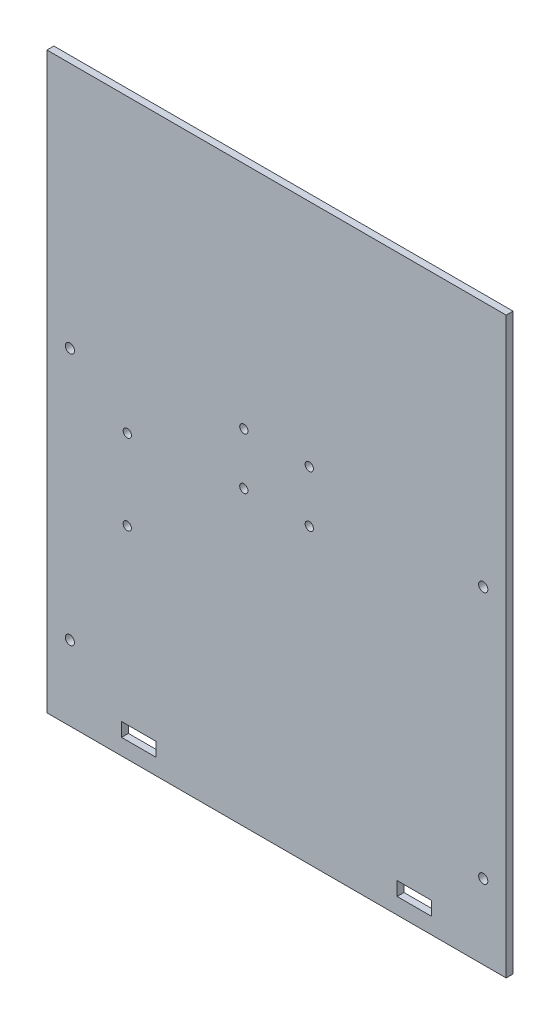
from build123d import *

# Parameters (mm, degrees)
ESBO_O1_W                = 200
ESBO_O1_H                = 250
ESBO_O1_R                = 1.8
ESBO_O1_R_2              = 2
ESBO_O1_W_2              = 15
ESBO_O1_H_2              = 6
RESSALTO_EXTRUS_O1_DEPTH = 3


with BuildPart() as part:
    # Esboço1 → Ressalto-extrusão1 (new body)
    with BuildSketch(Plane.XY):
        Rectangle(ESBO_O1_W, ESBO_O1_H)
        with Locations((-14.25, 25)):
            Circle(ESBO_O1_R, mode=Mode.SUBTRACT)
        with Locations((14.25, 25)):
            Circle(ESBO_O1_R, mode=Mode.SUBTRACT)
        with Locations((14.25, 2.5)):
            Circle(ESBO_O1_R, mode=Mode.SUBTRACT)
        with Locations((-14.25, 2.5)):
            Circle(ESBO_O1_R, mode=Mode.SUBTRACT)
        with Locations((-65, -2)):
            Circle(ESBO_O1_R, mode=Mode.SUBTRACT)
        with Locations((-65, -37)):
            Circle(ESBO_O1_R, mode=Mode.SUBTRACT)
        with Locations((-90, -92.5)):
            Circle(ESBO_O1_R_2, mode=Mode.SUBTRACT)
        with Locations((-90, 17.5)):
            Circle(ESBO_O1_R_2, mode=Mode.SUBTRACT)
        with Locations((90, 17.5)):
            Circle(ESBO_O1_R_2, mode=Mode.SUBTRACT)
        with Locations((90, -92.5)):
            Circle(ESBO_O1_R_2, mode=Mode.SUBTRACT)
        with Locations((-60, -115)):
            Rectangle(ESBO_O1_W_2, ESBO_O1_H_2, mode=Mode.SUBTRACT)
        with Locations((60, -115)):
            Rectangle(ESBO_O1_W_2, ESBO_O1_H_2, mode=Mode.SUBTRACT)
    extrude(amount=RESSALTO_EXTRUS_O1_DEPTH)


solid = part.part
